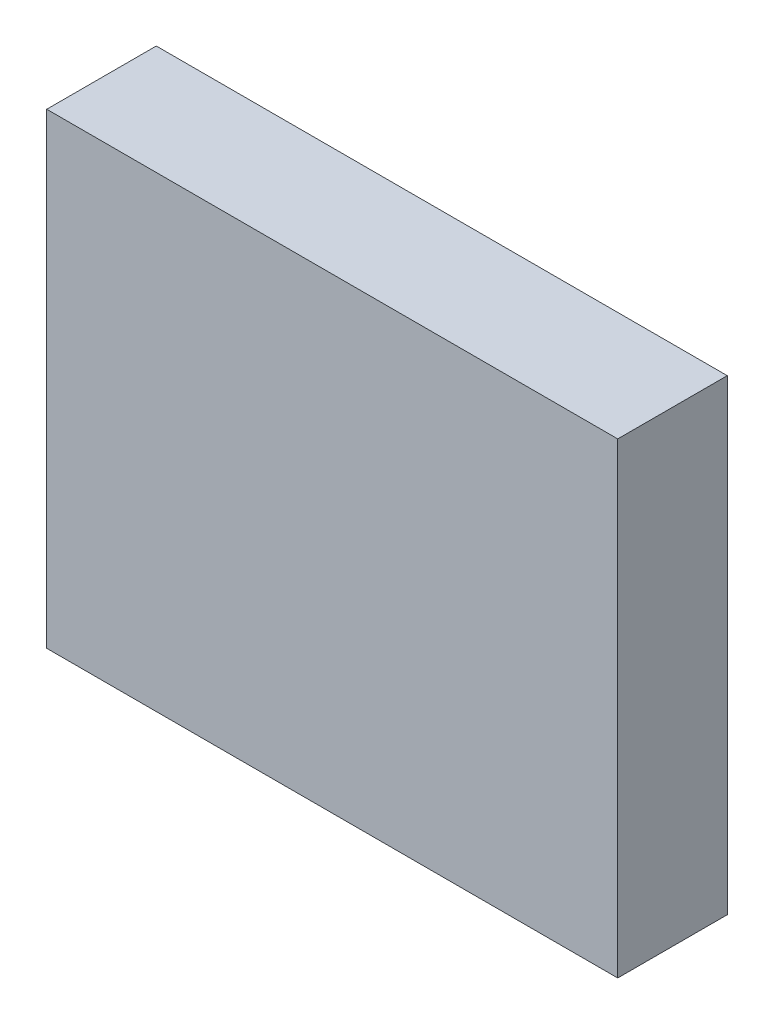
from build123d import *

# Parameters (mm, degrees)
ESBO_O1_W                = 156.39786889
ESBO_O1_H                = 127.879996654
RESSALTO_EXTRUS_O1_DEPTH = 30


with BuildPart() as part:
    # Esboço1 → Ressalto-extrusão1 (new body)
    with BuildSketch(Plane.XY):
        Rectangle(ESBO_O1_W, ESBO_O1_H)
    extrude(amount=RESSALTO_EXTRUS_O1_DEPTH)


solid = part.part
